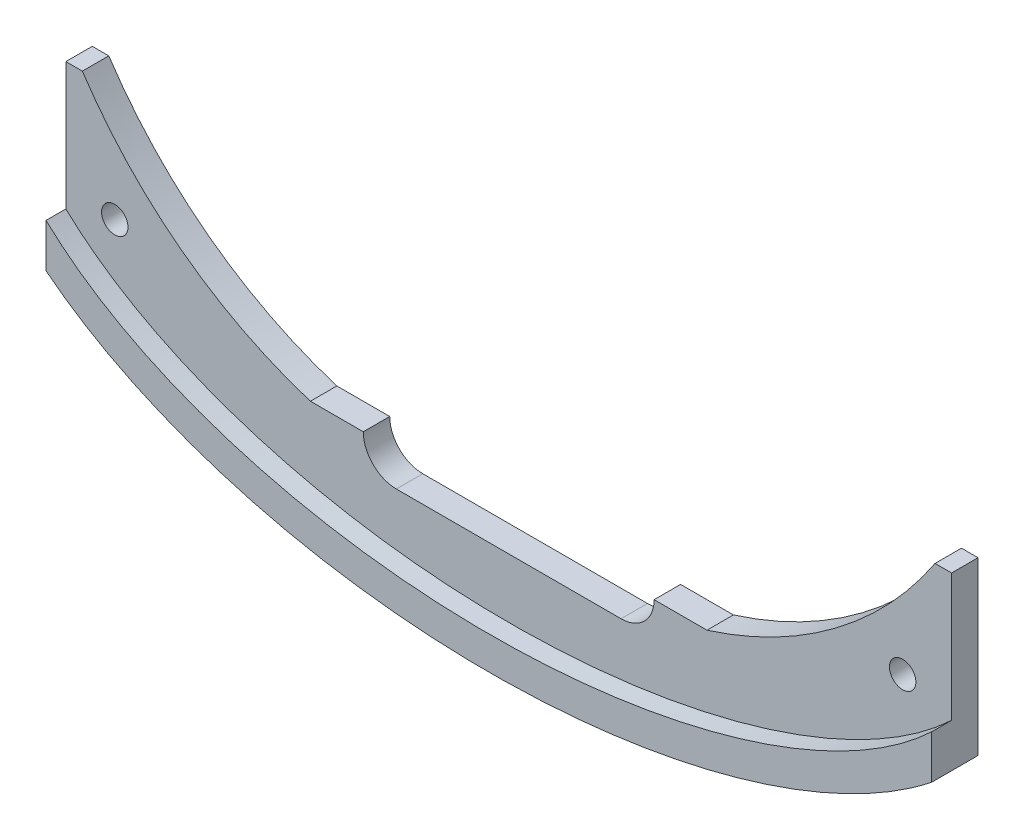
from build123d import *

# Parameters (mm, degrees)
CROQUIS1_R                 = 2
SALIENTE_EXTRUIR1_DEPTH    = 4
CROQUIS2_R                 = 2
SALIENTE_EXTRUIR2_DEPTH    = 4
SALIENTE_EXTRUIR3_START    = -11
SALIENTE_EXTRUIR3_DEPTH    = 11
SALIENTE_EXTRUIR4_DEPTH    = 4
CROQUIS5_W                 = 81.51
CROQUIS5_H                 = 4
SALIENTE_EXTRUIR5_DEPTH    = 45
CROQUIS6_R                 = 8.15
CROQUIS6_R_2               = 8.125
CROQUIS6_R_3               = 2.65
CORTAR_EXTRUIR1_DEPTH      = 25
SALIENTE_EXTRUIR9_START    = 2
CROQUIS17_RX               = 3.839992974
CROQUIS17_RY               = 1.30664232
SALIENTE_EXTRUIR9_DEPTH    = 2
CORTAR_EXTRUIR9_DEPTH      = 104.166128328
CORTAR_EXTRUIR9_DEPTH_BACK = 104.166128328
CROQUIS20_W                = 49.659393266
CROQUIS20_H                = 45
SALIENTE_EXTRUIR11_START   = -4
CROQUIS21_R                = 2
SALIENTE_EXTRUIR11_DEPTH   = 4
CORTAR_EXTRUIR10_DEPTH     = 10
CROQUIS24_W                = 44
CROQUIS24_H                = 5
CORTAR_EXTRUIR11_DEPTH     = 10
REDONDEO1_R                = 5


with BuildPart() as part:
    # Croquis1 → Saliente-Extruir1 (new body)
    with BuildSketch(Plane.XY):
        with BuildLine():
            Line((0, 14), (30, 14))
            ThreePointArc((30, 14), (49.490442899, 24.027104614), (64.5, 40))
            Line((64.5, 40), (76.5, 40))
            add(Edge.make_bspline(
                [(-76.5, 40), (-76.5, 0), (0, 0), (76.5, 0), (76.5, 40)],
                knots=[3.141592654, 3.141592654, 3.141592654, 4.71238898, 4.71238898, 6.283185307, 6.283185307, 6.283185307], degree=2, weights=[1, 0.707106781, 1, 0.707106781, 1]))
            Line((-76.5, 40), (-64.5, 40))
            ThreePointArc((-64.5, 40), (-49.490442899, 24.027104614), (-30, 14))
            Line((-30, 14), (0, 14))
        make_face()
        with Locations(Location((7.25, 8, 0), (0, 0, 180))):
            Circle(CROQUIS1_R, mode=Mode.SUBTRACT)
        with Locations(Location((59.6, 23, 0), (0, 0, 180))):
            Circle(CROQUIS1_R, mode=Mode.SUBTRACT)
        with Locations((-7.25, 8)):
            Circle(CROQUIS1_R, mode=Mode.SUBTRACT)
        with Locations((-59.6, 23)):
            Circle(CROQUIS1_R, mode=Mode.SUBTRACT)
    extrude(amount=SALIENTE_EXTRUIR1_DEPTH)



with BuildPart() as body_2:
    # Croquis2 → Saliente-Extruir2 (new body)
    with BuildSketch(Plane(origin=(0, 0, -3), x_dir=(-1, 0, 0), z_dir=(0, 0, -1))):
        with BuildLine():
            Line((64.5, 40), (76.5, 40))
            add(Edge.make_bspline(
                [(-76.5, 40), (-76.5, 0), (0, 0), (76.5, 0), (76.5, 40)],
                knots=[0, 0, 0, 1.570796327, 1.570796327, 3.141592654, 3.141592654, 3.141592654], degree=2, weights=[1, 0.707106781, 1, 0.707106781, 1]))
            Line((-76.5, 40), (-64.5, 40))
            ThreePointArc((-64.5, 40), (-49.490442899, 24.027104614), (-30, 14))
            Line((-30, 14), (30, 14))
            ThreePointArc((30, 14), (49.490442899, 24.027104614), (64.5, 40))
        make_face()
        with Locations((-59.6, 23)):
            Circle(CROQUIS2_R, mode=Mode.SUBTRACT)
        with Locations(Location((7.25, 8, 0), (0, 0, 180))):
            Circle(CROQUIS2_R, mode=Mode.SUBTRACT)
        with Locations((-7.25, 8)):
            Circle(CROQUIS2_R, mode=Mode.SUBTRACT)
        with Locations(Location((59.6, 23, 0), (0, 0, 180))):
            Circle(CROQUIS2_R, mode=Mode.SUBTRACT)
    extrude(amount=SALIENTE_EXTRUIR2_DEPTH)


with BuildPart() as part_1:
    add(part.part)

    add(body_2.part)  # Saliente-Extruir3 merges body 2
    # Croquis3 → Saliente-Extruir3 (add)
    with BuildSketch(Plane.XY.offset(4).offset(SALIENTE_EXTRUIR3_START)):
        with BuildLine():
            Line((-81.5, 40), (-76.5, 40))
            add(Edge.make_bspline(
                [(-76.5, 40), (-76.5, 0), (0, 0), (76.5, 0), (76.5, 40)],
                knots=[3.141592654, 3.141592654, 3.141592654, 4.71238898, 4.71238898, 6.283185307, 6.283185307, 6.283185307], degree=2, weights=[1, 0.707106781, 1, 0.707106781, 1]))
            Line((76.5, 40), (81.5, 40))
            add(Edge.make_bspline(
                [(-81.5, 40), (-81.5, 36.750529527), (-80.260995736, 30.280968201), (-73.321740908, 18.442769728), (-57.739765713, 6.428777931), (-31.065541534, -2.851449154), (0, -6.074275423), (31.065541534, -2.851449154), (57.739765713, 6.428777931), (73.321740908, 18.442769728), (80.260995736, 30.280968201), (81.5, 36.750529527), (81.5, 40)],
                knots=[3.141592654, 3.141592654, 3.141592654, 3.141592654, 3.337942194, 3.534291735, 3.926990817, 4.319689899, 4.71238898, 5.105088062, 5.497787144, 5.890486225, 6.086835766, 6.283185307, 6.283185307, 6.283185307, 6.283185307], degree=3))
        make_face()
    extrude(amount=SALIENTE_EXTRUIR3_DEPTH)

    # Croquis4 → Saliente-Extruir4 (add)
    with BuildSketch(Plane.XY):
        with BuildLine():
            Line((30, 14), (-30, 14))
            ThreePointArc((-30, 14), (-34.993144069, 15.797887582), (-39.821662304, 18))
            Line((-39.821662304, 18), (39.821662304, 18))
            ThreePointArc((39.821662304, 18), (34.993144069, 15.797887582), (30, 14))
        make_face()
    extrude(amount=SALIENTE_EXTRUIR4_DEPTH)

    # Croquis5 → Saliente-Extruir5 (add)
    with BuildSketch(Plane.XY.offset(4)):
        with Locations((0, 16)):
            Rectangle(CROQUIS5_W, CROQUIS5_H)
    extrude(amount=SALIENTE_EXTRUIR5_DEPTH)

    # Croquis6 → Cortar-Extruir1 (cut)
    with BuildSketch(Plane(origin=(0, 14, 0), x_dir=(-1, 0, 0), z_dir=(0, -1, 0))):
        with Locations(Location((13.075, -29, 0), (0, 0, 180))):
            Circle(CROQUIS6_R)
        with Locations(Location((-13.075, -29, 0), (0, 0, 180))):
            Circle(CROQUIS6_R_2)
        with Locations(Location((35.825963914, -43.403403929, 0), (0, 0, 180))):
            Circle(CROQUIS6_R_3)
        with Locations(Location((35.825963914, -33.403403929, 0), (0, 0, 180))):
            Circle(CROQUIS6_R_3)
        with Locations(Location((-35.825963914, -33.403403929, 0), (0, 0, 90))):
            Circle(CROQUIS6_R_3)
        with Locations(Location((-35.825963914, -43.403403929, 0), (0, 0, 90))):
            Circle(CROQUIS6_R_3)
    extrude(amount=-CORTAR_EXTRUIR1_DEPTH, mode=Mode.SUBTRACT)

    # Croquis17 → Saliente-Extruir9 (add)
    with BuildSketch(Plane.XZ.offset(-14).offset(SALIENTE_EXTRUIR9_START)):
        with Locations((-0.038170425, 20.627419709)):
            Ellipse(CROQUIS17_RX, CROQUIS17_RY)
        with BuildLine():
            Line((-20.599642293, 38.80557826), (-14.876279709, 42.835853775))
            ThreePointArc((-14.876279709, 42.835853775), (-13.482902837, 42.593984193), (-13.724772419, 41.200607322))
            Line((-13.724772419, 41.200607322), (-19.448135003, 37.170331807))
            ThreePointArc((-19.448135003, 37.170331807), (-20.841511875, 37.412201388), (-20.599642293, 38.80557826))
        make_face()
        with BuildLine():
            Line((14.79993886, 42.835853775), (20.523301444, 38.80557826))
            ThreePointArc((20.523301444, 38.80557826), (20.765171026, 37.412201388), (19.371794154, 37.170331807))
            Line((19.371794154, 37.170331807), (13.64843157, 41.200607322))
            ThreePointArc((13.64843157, 41.200607322), (13.406561988, 42.593984193), (14.79993886, 42.835853775))
        make_face()
        with BuildLine():
            ThreePointArc((-20.851449027, 31.439127003), (-21.115075712, 30.334047429), (-21.222470325, 29.203045089))
            add(Edge.make_bspline(
                [(-25.476510975, 33.88579792), (-24.936658507, 29.766870668), (-23.959082251, 29.798200281), (-21.222470325, 29.203045089)],
                knots=[0, 0, 0, 0, 0.707855223, 0.707855223, 0.707855223, 0.707855223], degree=3))
            add(Edge.make_bspline(
                [(-20.851449027, 31.439127003), (-23.607664548, 31.252260239), (-25.476510975, 33.88579792)],
                knots=[0, 0, 0, 1, 1, 1], degree=2))
        make_face()
        with BuildLine():
            ThreePointArc((-10.806585595, 17.555254071), (0.181750729, 15.470071818), (11.170087054, 17.555254071))
            ThreePointArc((11.170087054, 17.555254071), (11.818495985, 17.273179866), (11.53642178, 16.624770934))
            ThreePointArc((11.53642178, 16.624770934), (0.181750729, 14.470071818), (-11.172920321, 16.624770934))
            ThreePointArc((-11.172920321, 16.624770934), (-11.454994527, 17.273179866), (-10.806585595, 17.555254071))
        make_face()
        with BuildLine():
            ThreePointArc((20.775108177, 31.439127003), (21.038734863, 30.334047429), (21.146129476, 29.203045089))
            add(Edge.make_bspline(
                [(25.400170126, 33.88579792), (24.860317658, 29.766870668), (23.882741402, 29.798200281), (21.146129476, 29.203045089)],
                knots=[0, 0, 0, 0, 0.707855223, 0.707855223, 0.707855223, 0.707855223], degree=3))
            add(Edge.make_bspline(
                [(20.775108177, 31.439127003), (23.531323698, 31.252260239), (25.400170126, 33.88579792)],
                knots=[0, 0, 0, 1, 1, 1], degree=2))
        make_face()
    extrude(amount=-SALIENTE_EXTRUIR9_DEPTH)

    # Croquis20 → Cortar-Extruir9 (cut, two sides: drawn at the far end of the back side and taken through both)
    with BuildSketch(Plane(origin=(0, 0, 0), x_dir=(0, 0, -1), z_dir=(1, 0, 0)).offset(-CORTAR_EXTRUIR9_DEPTH_BACK)):
        with Locations((-24.829696633, 17.5)):
            Rectangle(CROQUIS20_W, CROQUIS20_H)
    extrude(amount=CORTAR_EXTRUIR9_DEPTH + CORTAR_EXTRUIR9_DEPTH_BACK, mode=Mode.SUBTRACT)

    # Croquis21 → Saliente-Extruir11 (add)
    with BuildSketch(Plane(origin=(0, 0, -7), x_dir=(-1, 0, 0), z_dir=(0, 0, -1)).offset(SALIENTE_EXTRUIR11_START)):
        with Locations((-7.25, 8)):
            Circle(CROQUIS21_R)
        with Locations((7.25, 8)):
            Circle(CROQUIS21_R)
    extrude(amount=SALIENTE_EXTRUIR11_DEPTH)

    # Croquis22 → Cortar-Extruir10 (cut)
    with BuildSketch(Plane(origin=(0, 0, -7), x_dir=(-1, 0, 0), z_dir=(0, 0, -1))):
        with BuildLine():
            add(Edge.make_bspline(
                [(67, 14.079334571), (69.923442282, 16.400361441), (75.115064172, 21.502135215), (80.260995736, 30.280968201), (81.5, 36.750529527), (81.5, 40)],
                knots=[5.700758908, 5.700758908, 5.700758908, 5.700758908, 5.890486225, 6.086835766, 6.283185307, 6.283185307, 6.283185307, 6.283185307], degree=3))
            Line((67, 14.079334571), (95.202845177, 14.079334571))
            Line((95.202845177, 14.079334571), (95.202845177, 40))
            Line((95.202845177, 40), (81.5, 40))
        make_face()
        with BuildLine():
            add(Edge.make_bspline(
                [(-81.5, 40), (-81.5, 36.750529527), (-80.260995736, 30.280968201), (-75.115064172, 21.502135215), (-69.923442282, 16.400361441), (-67, 14.079334571)],
                knots=[3.141592654, 3.141592654, 3.141592654, 3.141592654, 3.337942194, 3.534291735, 3.724019052, 3.724019052, 3.724019052, 3.724019052], degree=3))
            Line((-67, 14.079334571), (-67, 40))
            Line((-67, 40), (-81.5, 40))
        make_face()
        with BuildLine():
            Line((-97.827923629, 14.079334571), (-67, 14.079334571))
            add(Edge.make_bspline(
                [(-81.5, 40), (-81.5, 36.750529527), (-80.260995736, 30.280968201), (-75.115064172, 21.502135215), (-69.923442282, 16.400361441), (-67, 14.079334571)],
                knots=[3.141592654, 3.141592654, 3.141592654, 3.141592654, 3.337942194, 3.534291735, 3.724019052, 3.724019052, 3.724019052, 3.724019052], degree=3))
            Line((-81.5, 40), (-97.827923629, 40))
            Line((-97.827923629, 40), (-97.827923629, 14.079334571))
        make_face()
        with BuildLine():
            Line((81.5, 40), (67, 40))
            Line((67, 40), (67, 14.079334571))
            add(Edge.make_bspline(
                [(67, 14.079334571), (69.923442282, 16.400361441), (75.115064172, 21.502135215), (80.260995736, 30.280968201), (81.5, 36.750529527), (81.5, 40)],
                knots=[5.700758908, 5.700758908, 5.700758908, 5.700758908, 5.890486225, 6.086835766, 6.283185307, 6.283185307, 6.283185307, 6.283185307], degree=3))
        make_face()
    extrude(amount=-CORTAR_EXTRUIR10_DEPTH, mode=Mode.SUBTRACT)

    # Croquis24 → Cortar-Extruir11 (cut)
    with BuildSketch(Plane(origin=(0, 0, -7), x_dir=(-1, 0, 0), z_dir=(0, 0, -1))):
        with Locations((0, 11.5)):
            Rectangle(CROQUIS24_W, CROQUIS24_H)
    extrude(amount=-CORTAR_EXTRUIR11_DEPTH, mode=Mode.SUBTRACT)

    # Redondeo1
    redondeo1_edges = [part_1.edges().sort_by_distance(p)[0] for p in [
        (-22, 9, -5),
        (22, 9, -5),
    ]]
    fillet(redondeo1_edges, radius=REDONDEO1_R - 0.0001)  # a hair under: the kernel refuses the full size


solid = part_1.part
